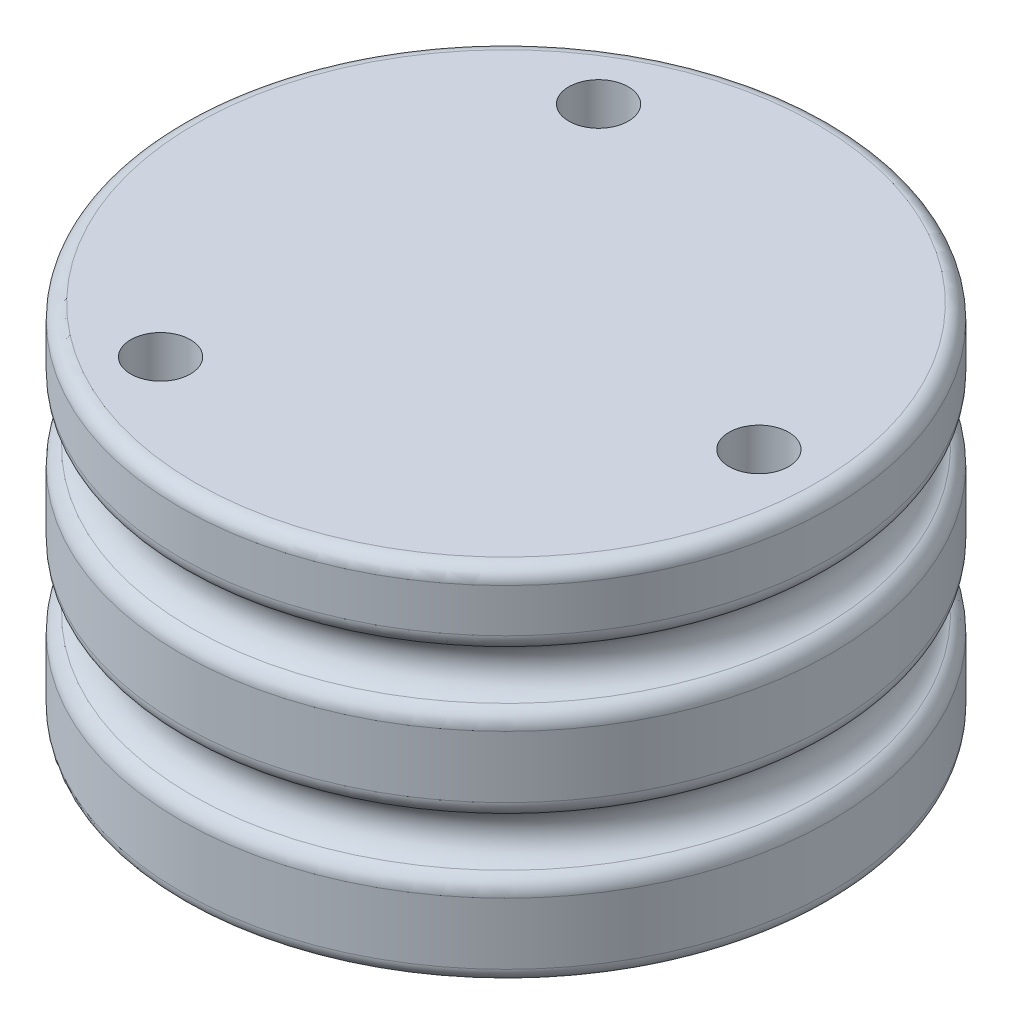
from build123d import *
from OCP.BRepFilletAPI import BRepFilletAPI_MakeFillet

# Parameters (mm, degrees)
ESQUISSE2_R             = 1.65
ENL_V_MAT_EXTRU_1_DEPTH = 33.372828112
ENL_V_MAT_EXTRU_2_DEPTH = 3
CHANFREIN1_SIZE         = 0.6
CHANFREIN1_SIZE_2       = 17.18175197
CONG_1_R1               = 1
CONG_1_R2               = 0.8
ESQUISSE4_R             = 1.5
BOSS_EXTRU_1_DEPTH      = 0.3
CONG_3_R                = 1
ESQUISSE5_R             = 11.97255102
BOSS_EXTRU_2_DEPTH      = 16


with BuildPart() as part:
    # Esquisse1 → Révolution1 (revolve)
    with BuildSketch(Plane.XY, mode=Mode.PRIVATE) as r_volution1_sk:
        with BuildLine():
            Line((18, 17), (10.6, 17))
            Line((10.6, 17), (10.6, 1))
            Line((10.6, 1), (9.6, 1))
            Line((9.6, 1), (9.6, 0.7))
            Line((9.6, 0.7), (5.3, 0.7))
            Line((5.3, 0.7), (5.3, 1))
            Line((5.3, 1), (3.3, 1))
            Line((3.3, 1), (3.3, 0))
            Line((3.3, 0), (10.578545573, -3))
            Line((10.578545573, -3), (18, -3))
            Line((18, -3), (18, 2))
            ThreePointArc((18, 2), (16.5, 3.5), (18, 5))
            Line((18, 5), (18, 10))
            ThreePointArc((18, 10), (16.5, 11.5), (18, 13))
            Line((18, 13), (18, 17))
        make_face()
    revolve(r_volution1_sk.sketch.rotate(Axis((0, 8, 0), (0, -1, 0)), 90), axis=Axis((0, 8, 0), (0, -1, 0)))

    # Esquisse2 → Enlèv. mat.-Extru.1 (cut, through all)
    with BuildSketch(Plane(origin=(0, 17, 0), x_dir=(1, 0, 0), z_dir=(0, 1, 0))):
        with Locations(Location((14, 0, 0), (0, 0, 270))):
            Circle(ESQUISSE2_R)
        with Locations(Location((-7, -12.124355653, 0), (0, 0, 270))):
            Circle(ESQUISSE2_R)
        with Locations(Location((-7, 12.124355653, 0), (0, 0, 270))):
            Circle(ESQUISSE2_R)
    extrude(amount=-ENL_V_MAT_EXTRU_1_DEPTH, mode=Mode.SUBTRACT)

    # Esquisse3 → Enlèv. mat.-Extru.2 (cut)
    with BuildSketch(Plane.XZ.offset(3)):
        Polygon((14, -3.464101615), (17, -1.732050808), (17, 1.732050808), (14, 3.464101615), (11, 1.732050808), (11, -1.732050808), align=None)
        Polygon((-7, -8.660254038), (-10, -10.392304845), (-10, -13.856406461), (-7, -15.588457268), (-4, -13.856406461), (-4, -10.392304845), align=None)
        Polygon((-4, 10.392304845), (-4, 13.856406461), (-7, 15.588457268), (-10, 13.856406461), (-10, 10.392304845), (-7, 8.660254038), align=None)
    extrude(amount=-ENL_V_MAT_EXTRU_2_DEPTH, mode=Mode.SUBTRACT)

    # Chanfrein1
    # the kernel refuses this chamfer: 17.18175197, 0.6 mm, written as the material it takes off along each edge
    with BuildSketch(Plane(origin=(0, 17, 0), x_dir=(0, 0, 1), z_dir=(1, 0, 0))) as chanfrein1_piece_1_section:
        Polygon((10.6 + CHANFREIN1_SIZE, 0), (10.6, CHANFREIN1_SIZE_2), (10.6, 0), align=None)
    chanfrein1_piece_1 = revolve(axis=Axis((0, 17, 0), (0, -1, 0)), mode=Mode.PRIVATE)
    chanfrein1_piece_1 = split(chanfrein1_piece_1, bisect_by=Plane(origin=(0, 1, -10.842656471), z_dir=(0, 1, 0)), keep=Keep.TOP, mode=Mode.PRIVATE)
    add(chanfrein1_piece_1, mode=Mode.SUBTRACT)

    # Congé1: one fillet with a radius per group of edges: ONE call of the kernel's fillet builder (fillet() takes one radius for all edges)
    cong_1_edges_1 = [part.edges().sort_by_distance(p)[0] for p in [
        (0, -3, -10.578545573),
    ]]
    cong_1_edges_2 = [part.edges().sort_by_distance(p)[0] for p in [
        (0, 17, -11.2),
        (0, -3, -18),
        (0, 17, -18),
    ]]
    cong_1 = BRepFilletAPI_MakeFillet(part.part.solid().wrapped)
    for e in cong_1_edges_1:
        cong_1.Add(CONG_1_R1, e.wrapped)
    for e in cong_1_edges_2:
        cong_1.Add(CONG_1_R2, e.wrapped)
    add(Compound.cast(cong_1.Shape()), mode=Mode.REPLACE)

    # Esquisse4 → Boss.-Extru.1 (add)
    with BuildSketch(Plane(origin=(0, 0.7, 0), x_dir=(1, 0, 0), z_dir=(0, 1, 0))):
        with Locations(Location((0, 7.5, 0), (0, 0, 90))):
            Circle(ESQUISSE4_R)
        with Locations(Location((0, -7.5, 0), (0, 0, 90))):
            Circle(ESQUISSE4_R)
    extrude(amount=BOSS_EXTRU_1_DEPTH)

    # Congé3
    cong_3_edges = [part.edges().sort_by_distance(p)[0] for p in [
        (0, 2, -18),
        (0, 13, -18),
        (0, 10, -18),
        (0, 5, -18),
    ]]
    fillet(cong_3_edges, radius=CONG_3_R)

    # Esquisse5 → Boss.-Extru.2 (add)
    with BuildSketch(Plane(origin=(0, 17, 0), x_dir=(1, 0, 0), z_dir=(0, 1, 0))):
        Circle(ESQUISSE5_R)
    extrude(amount=-BOSS_EXTRU_2_DEPTH)


solid = part.part
